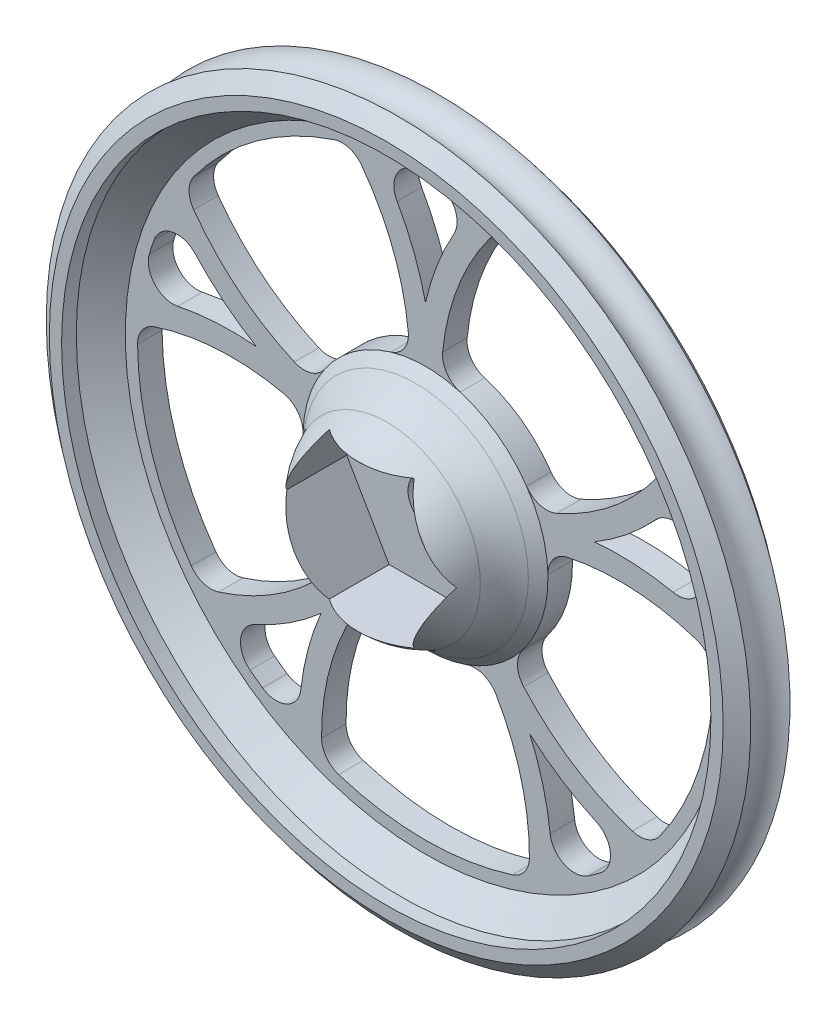
from build123d import *

# Parameters (mm, degrees)
CHAMFER1_SIZE            = 2
CUT_EXTRUDE1_DEPTH       = 6
CUT_EXTRUDE2_DEPTH       = 42.028953192
FILLET2_R                = 2
CIRPATTERN1_COUNT        = 5
FILLET2_OF_CIRPATTERN1_R = 2
FILLET3_R                = 7.5
FILLET4_R                = 7.5


with BuildPart() as part:
    # Sketch1 → Revolve1 (revolve)
    with BuildSketch(Plane(origin=(0, 0, 0), x_dir=(0, 0, -1), z_dir=(1, 0, 0)), mode=Mode.PRIVATE) as revolve1_sk:
        with BuildLine():
            Line((1, 1.925), (-1, 1.925))
            Line((-1, 1.925), (-6.5, 1.925))
            Line((-6.5, 1.925), (-6.5, 8))
            Line((-6.5, 8), (-1, 8))
            Line((-1, 8), (-1, 26.5))
            Line((-1, 26.5), (-4.201562119, 26.5))
            Line((-4.201562119, 26.5), (-4.201562119, 27.5))
            Line((-4.201562119, 27.5), (-3.201562119, 28.75))
            ThreePointArc((-3.201562119, 28.75), (-1.600781059, 27.5), (0, 28.75))
            Line((0, 28.75), (1, 27.5))
            Line((1, 27.5), (1, 26.5))
            Line((1, 26.5), (1, 1.925))
        make_face()
    revolve(revolve1_sk.sketch.rotate(Axis((0, 0, 0), (0, 0, 1)), 90), axis=Axis((0, 0, 0), (0, 0, 1)))

    # Chamfer1
    chamfer1_edges = [part.edges().sort_by_distance(p)[0] for p in [
        (8, 0, 1),
        (26.5, 0, 1),
        (8, 0, 6.5),
    ]]
    chamfer(chamfer1_edges, length=CHAMFER1_SIZE)

    # Sketch2 → Cut-Extrude1 (cut)
    with BuildSketch(Plane.XY.offset(6.5)):
        Polygon((3.464101615, 6), (-3.464101615, 6), (-6.92820323, 0), (-3.464101615, -6), (3.464101615, -6), (6.92820323, 0), align=None)
    extrude(amount=-CUT_EXTRUDE1_DEPTH, mode=Mode.SUBTRACT)

    # Sketch4 → Cut-Extrude2 (cut, symmetric)
    with BuildSketch(Plane.XY.offset(1)):
        with BuildLine():
            ThreePointArc((-9.025852843, 4.305110968), (-5.877852523, 8.090169944), (-1.305261922, 9.914448614))
            ThreePointArc((-1.305261922, 9.914448614), (-2.56946738, 16.726937639), (-6.08224756, 22.699256918))
            ThreePointArc((-6.08224756, 22.699256918), (-13.812953429, 19.011899368), (-19.708758347, 12.799017323))
            ThreePointArc((-19.708758347, 12.799017323), (-15.114253953, 7.612616689), (-9.025852843, 4.305110968))
        make_face()
        with BuildLine():
            ThreePointArc((-4.080732175, 23.142982196), (0, 23.5), (4.080732175, 23.142982196))
            ThreePointArc((4.080732175, 23.142982196), (1.56147319, 19.047006697), (0, 14.498877126))
            ThreePointArc((0, 14.498877126), (-1.56147319, 19.047006697), (-4.080732175, 23.142982196))
        make_face()
    cut_extrude2 = extrude(amount=CUT_EXTRUDE2_DEPTH, both=True, mode=Mode.SUBTRACT)

    # Fillet2
    fillet2_edges = [part.edges().sort_by_distance(p)[0] for p in [
        (-4.080732175, 23.142982196, 0),
        (4.080732175, 23.142982196, 0),
        (-1.305261922, 9.914448614, 0),
        (-6.08224756, 22.699256918, 0),
        (-9.025852843, 4.305110968, 0),
        (-19.708758347, 12.799017323, 0),
    ]]
    fillet(fillet2_edges, radius=FILLET2_R)

    # CirPattern1: Cut-Extrude2 ×5 about axis
    cirpattern1_axis = Axis((0, 0, 0), (0, 0, 1))
    for i in range(1, CIRPATTERN1_COUNT):
        add(cut_extrude2.rotate(cirpattern1_axis, i * 360 / CIRPATTERN1_COUNT), mode=Mode.SUBTRACT)

    # Fillet2 of CirPattern1
    fillet2_of_cirpattern1_edges = [part.edges().sort_by_distance(p)[0] for p in [
        (-23.271299615, 3.270567873, 0),
        (-20.749268432, 11.032581725, 0),
        (-9.832549076, 1.822355255, 0),
        (-23.467794067, 1.229894972, 0),
        (-6.883545757, -7.25374371, 0),
        (-18.262930094, -14.78902919, 0),
        (-10.30172195, -21.121660088, 0),
        (-16.904485308, -16.324471706, 0),
        (-4.771587603, -8.788171127, 0),
        (-8.421646814, -21.939140023, 0),
        (4.771587603, -8.788171127, 0),
        (8.421646814, -21.939140023, 0),
        (16.904485308, -16.324471706, 0),
        (10.30172195, -21.121660088, 0),
        (6.883545757, -7.25374371, 0),
        (18.262930094, -14.78902919, 0),
        (9.832549076, 1.822355255, 0),
        (23.467794067, 1.229894972, 0),
        (20.749268432, 11.032581725, 0),
        (23.271299615, 3.270567873, 0),
        (9.025852843, 4.305110968, 0),
        (19.708758347, 12.799017323, 0),
        (1.305261922, 9.914448614, 0),
        (6.08224756, 22.699256918, 0),
    ]]
    fillet(fillet2_of_cirpattern1_edges, radius=FILLET2_OF_CIRPATTERN1_R)

    # Fillet3
    # the kernel refuses this fillet: 7.5 mm, written as the material it takes off along each edge
    with BuildSketch(Plane(origin=(0, 0, 4.5), x_dir=(-1, 0, 0), z_dir=(0, 1, 0))) as fillet3_piece_1:
        with BuildLine():
            CenterArc((0.727792874, -3.334394592), FILLET3_R, 14.157365729, 30.842634271)
            Line((6.031093733, 1.968906267), (6.13715975, 2.074972284))
            Line((6.13715975, 2.074972284), (8.106066017, 0.106066017))
            Line((8.106066017, 0.106066017), (8.15, 0))
            ThreePointArc((8.15, 0), (8.15, -0.75), (8.145444143, -1.463312108))
            Line((8.145444143, -1.463312108), (8, -1.5))
        make_face()
    revolve(axis=Axis((0, 0, 4.5), (0, 0, 1)), mode=Mode.SUBTRACT)

    # Fillet4
    fillet4_edges = [part.edges().sort_by_distance(p)[0] for p in [
        (8, 0, 3),
    ]]
    fillet(fillet4_edges, radius=FILLET4_R)


solid = part.part
